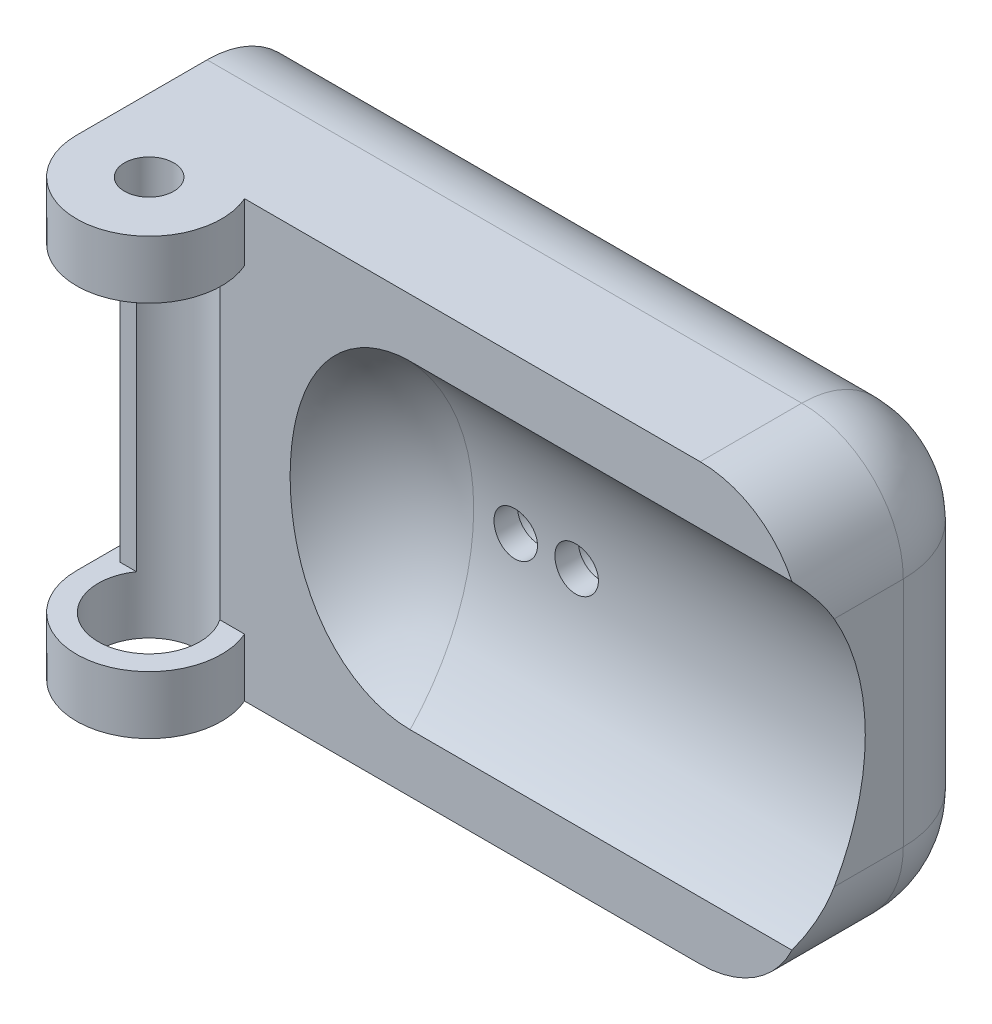
from build123d import *

# Parameters (mm, degrees)
CROQUIS1_W                  = 48
CROQUIS1_H                  = 30
SALIENTE_EXTRUIR1_DEPTH     = 14
CORTAR_EXTRUIR1_DEPTH       = 37
REDONDEO2_R                 = 7
CROQUIS3_W                  = 20
CROQUIS3_H                  = 16
CORTAR_EXTRUIR2_DEPTH       = 3
CROQUIS5_R                  = 1.5
CORTAR_EXTRUIR3_DEPTH       = 12
CROQUIS10_R                 = 6.927737764
CORTAR_EXTRUIR9_DEPTH       = 3
CORTAR_EXTRUIR10_REACH      = 54.494
CORTAR_EXTRUIR10_END_RADIUS = 6.927737764
CROQUIS11_R                 = 3
SALIENTE_EXTRUIR5_DEPTH     = 4
CORTAR_EXTRUIR14_REACH      = 59.227
CROQUIS12_R                 = 3.5
CORTAR_EXTRUIR16_DEPTH      = 22
CROQUIS16_R                 = 2
CORTAR_EXTRUIR17_DEPTH      = 2
CROQUIS17_W                 = 3
CROQUIS17_H                 = 5
CORTAR_EXTRUIR18_DEPTH      = 3
CROQUIS18_R                 = 1.7
CORTAR_EXTRUIR19_DEPTH      = 4
REDONDEO3_R                 = 10


with BuildPart() as part:
    # Croquis1 → Saliente-Extruir1 (new body)
    with BuildSketch(Plane.XY):
        with Locations((-19.976765257, 0.987352556)):
            Rectangle(CROQUIS1_W, CROQUIS1_H)
    extrude(amount=SALIENTE_EXTRUIR1_DEPTH)

    # Croquis2 → Cortar-Extruir1 (cut)
    with BuildSketch(Plane(origin=(4.023234743, 0, 0), x_dir=(0, 0, -1), z_dir=(1, 0, 0))):
        with BuildLine():
            ThreePointArc((-14, -10.012647444), (-9.618950039, 0.987352556), (-14, 11.987352556))
            Line((-14, 11.987352556), (-14, -10.012647444))
        make_face()
    extrude(amount=-CORTAR_EXTRUIR1_DEPTH, mode=Mode.SUBTRACT)

    # Redondeo2
    # the kernel refuses this fillet: 7 mm, written as the material it takes off along each edge
    with BuildSketch(Plane(origin=(-2.976765257, -7.012647444, 7), x_dir=(0, 0, -1), z_dir=(1, 0, 0))) as redondeo2_piece_1_section:
        Polygon((0, 0), (REDONDEO2_R, 0), (REDONDEO2_R, -REDONDEO2_R), (0, -REDONDEO2_R), align=None)
    redondeo2_piece_1 = extrude(amount=REDONDEO2_R, mode=Mode.PRIVATE)
    redondeo2_piece_1 = redondeo2_piece_1 - Plane(origin=(-2.976765257, -7.012647444, 7), x_dir=(0, 0.7071067811865475, 0.7071067811865475), z_dir=(1, 0, 0)) * Sphere(REDONDEO2_R, mode=Mode.PRIVATE)
    add(redondeo2_piece_1, mode=Mode.SUBTRACT)
    with BuildSketch(Plane(origin=(-2.976765257, 8.987352556, 7), x_dir=(1, 0, 0), z_dir=(0, 1, 0))) as redondeo2_piece_2_section:
        Polygon((0, 0), (REDONDEO2_R, 0), (REDONDEO2_R, REDONDEO2_R), (0, REDONDEO2_R), align=None)
    redondeo2_piece_2 = extrude(amount=REDONDEO2_R, mode=Mode.PRIVATE)
    redondeo2_piece_2 = redondeo2_piece_2 - Plane(origin=(-2.976765257, 8.987352556, 7), x_dir=(-0.7071067811865475, 0, 0.7071067811865475), z_dir=(0, 1, 0)) * Sphere(REDONDEO2_R, mode=Mode.PRIVATE)
    add(redondeo2_piece_2, mode=Mode.SUBTRACT)
    with BuildSketch(Plane(origin=(-2.976765257, -14.012647444, 0), x_dir=(0, 1, 0), z_dir=(-1, 0, 0))) as redondeo2_piece_3:
        with BuildLine():
            CenterArc((REDONDEO2_R, -REDONDEO2_R), REDONDEO2_R, 90, 90)
            Line((0, -REDONDEO2_R), (0, 0))
            Line((0, 0), (REDONDEO2_R, 0))
        make_face()
    extrude(amount=58.5, mode=Mode.SUBTRACT)
    with BuildSketch(Plane(origin=(4.023234743, 8.987352556, 0), x_dir=(0, 0, 1), z_dir=(0, -1, 0))) as redondeo2_piece_4:
        with BuildLine():
            CenterArc((REDONDEO2_R, REDONDEO2_R), REDONDEO2_R, 180, 90)
            Line((0, REDONDEO2_R), (0, 0))
            Line((0, 0), (REDONDEO2_R, 0))
        make_face()
    extrude(amount=16, mode=Mode.SUBTRACT)
    with BuildSketch(Plane(origin=(-61.476765257, 15.987352556, 0), x_dir=(0, 0, 1), z_dir=(1, 0, 0))) as redondeo2_piece_5:
        with BuildLine():
            CenterArc((REDONDEO2_R, REDONDEO2_R), REDONDEO2_R, 180, 90)
            Line((0, REDONDEO2_R), (0, 0))
            Line((0, 0), (REDONDEO2_R, 0))
        make_face()
    extrude(amount=58.5, mode=Mode.SUBTRACT)
    with BuildSketch(Plane(origin=(4.023234743, 15.987352556, 7), x_dir=(-1, 0, 0), z_dir=(0, 0, 1)), Plane(origin=(4.023234743, -14.012647444, 7), x_dir=(0, 1, 0), z_dir=(0, 0, 1))) as redondeo2_piece_6:
        with BuildLine():
            CenterArc((REDONDEO2_R, REDONDEO2_R), REDONDEO2_R, 180, 90)
            Line((0, REDONDEO2_R), (0, 0))
            Line((0, 0), (REDONDEO2_R, 0))
        make_face()
    extrude(amount=24.5, mode=Mode.SUBTRACT)

    # Croquis3 → Cortar-Extruir2 (cut)
    with BuildSketch(Plane(origin=(0, 0, 0), x_dir=(-1, 0, 0), z_dir=(0, 0, -1))):
        with Locations((18.976765257, 0.987352556)):
            Rectangle(CROQUIS3_W, CROQUIS3_H)
    extrude(amount=-CORTAR_EXTRUIR2_DEPTH, mode=Mode.SUBTRACT)

    # Croquis5 → Cortar-Extruir3 (cut)
    with BuildSketch(Plane(origin=(0, 0, 0), x_dir=(-1, 0, 0), z_dir=(0, 0, -1))):
        with Locations((20.076765257, 0.987352556)):
            Circle(CROQUIS5_R)
        with Locations((15.876765257, 0.987352556)):
            Circle(CROQUIS5_R)
    extrude(amount=-CORTAR_EXTRUIR3_DEPTH, mode=Mode.SUBTRACT)

    # Croquis10 → Cortar-Extruir9 (cut)
    with BuildSketch(Plane(origin=(0, 0, 3), x_dir=(-1, 0, 0), z_dir=(0, 0, -1))):
        with Locations((17.983902927, 0.987352556)):
            Circle(CROQUIS10_R)
    extrude(amount=-CORTAR_EXTRUIR9_DEPTH, mode=Mode.SUBTRACT)

    # Cortar-Extruir10: up to this cylinder (the profile starts outside it)
    cortar_extruir10_end = Plane(origin=(-17.983902927, 0.987352556, 4.236484), z_dir=(0, 0, -1)) * Cylinder(CORTAR_EXTRUIR10_END_RADIUS, 123.843475528, mode=Mode.PRIVATE)
    # Croquis11 → Cortar-Extruir10 (cut, up to the surface)
    with BuildSketch(Plane.ZY.offset(43.976765257), mode=Mode.PRIVATE) as cortar_extruir10_sk1:
        with Locations(Location((4.236484056, 0.987352556, 0), (0, 0, 270))):
            Circle(CROQUIS11_R)
    cortar_extruir10_tool1 = extrude(cortar_extruir10_sk1.sketch, amount=-CORTAR_EXTRUIR10_REACH, mode=Mode.PRIVATE) - cortar_extruir10_end
    add(cortar_extruir10_tool1.solids().sort_by_distance((-43.976765, 0.987353, 4.236484))[0], mode=Mode.SUBTRACT)

    # Croquis14 → Saliente-Extruir5 (add)
    with BuildSketch(Plane.XZ.offset(14.012647444)):
        with BuildLine():
            ThreePointArc((-33.976765257, 16), (-38.976765257, 21), (-43.976765257, 16))
            ThreePointArc((-43.976765257, 16), (-43.871296822, 14.978451782), (-43.559340952, 14))
            Line((-43.559340952, 14), (-34.394189562, 14))
            ThreePointArc((-34.394189562, 14), (-34.082233692, 14.978451782), (-33.976765257, 16))
        make_face()
        with BuildLine():
            Line((-34.394189562, 14), (-43.559340952, 14))
            ThreePointArc((-43.559340952, 14), (-38.976765257, 11), (-34.394189562, 14))
        make_face()
        with BuildLine():
            ThreePointArc((-43.559340952, 14), (-43.871296822, 14.978451782), (-43.976765257, 16))
            Line((-43.976765257, 16), (-43.976765257, 14))
            Line((-43.976765257, 14), (-43.559340952, 14))
        make_face()
    saliente_extruir5 = extrude(amount=-SALIENTE_EXTRUIR5_DEPTH)

    # Simetría1: Saliente-Extruir5 across plane
    add(saliente_extruir5.mirror(Plane.ZX.offset(0.987352556)))

    # Cortar-Extruir14: up to this face of the body (flat: up to its plane)
    cortar_extruir14_end = Plane(part.part.faces().sort_by_distance((-38.999365489, 11.987352556, 17.080483699))[0])
    # Croquis12 → Cortar-Extruir14 (cut, up to the picked face)
    with BuildSketch(Plane.XZ.offset(14.012647444), mode=Mode.PRIVATE) as cortar_extruir14_sk1:
        with Locations(Location((-38.976765257, 16, 0), (0, 0, 270))):
            Circle(CROQUIS12_R)
    cortar_extruir14_tool1 = split(extrude(cortar_extruir14_sk1.sketch, amount=-CORTAR_EXTRUIR14_REACH, mode=Mode.PRIVATE), bisect_by=cortar_extruir14_end, keep=Keep.BOTH, mode=Mode.PRIVATE)
    add(cortar_extruir14_tool1.solids().sort_by(Axis((-38.976765, -14.012647, 16), (0, 1, 0)))[0], mode=Mode.SUBTRACT)

    # Croquis15 → Cortar-Extruir16 (cut)
    with BuildSketch(Plane.XZ.offset(10.012647444)):
        Polygon((-43.976765257, 16), (-43.976765257, 12), (-41.976765257, 16), align=None)
    extrude(amount=-CORTAR_EXTRUIR16_DEPTH, mode=Mode.SUBTRACT)

    # Croquis16 → Cortar-Extruir17 (cut)
    with BuildSketch(Plane(origin=(0, 0, 6), x_dir=(-1, 0, 0), z_dir=(0, 0, -1))):
        with Locations((15.876765257, 0.987352556)):
            Circle(CROQUIS16_R)
        with Locations((20.076765257, 0.987352556)):
            Circle(CROQUIS16_R)
    extrude(amount=-CORTAR_EXTRUIR17_DEPTH, mode=Mode.SUBTRACT)

    # Croquis17 → Cortar-Extruir18 (cut)
    with BuildSketch(Plane(origin=(0, 0, 0), x_dir=(-1, 0, 0), z_dir=(0, 0, -1))):
        with Locations((30.476765257, 0.987352556)):
            Rectangle(CROQUIS17_W, CROQUIS17_H)
    extrude(amount=-CORTAR_EXTRUIR18_DEPTH, mode=Mode.SUBTRACT)

    # Croquis18 → Cortar-Extruir19 (cut)
    with BuildSketch(Plane(origin=(0, 15.987352556, 0), x_dir=(1, 0, 0), z_dir=(0, 1, 0))):
        with Locations(Location((-38.976765257, -16, 0), (0, 0, 270))):
            Circle(CROQUIS18_R)
    extrude(amount=-CORTAR_EXTRUIR19_DEPTH, mode=Mode.SUBTRACT)

    # Redondeo3
    # the kernel refuses this fillet: 10 mm, written as the material it adds along each edge
    with BuildSketch(Plane(origin=(-32.976765257, 0.987352556, 25.618950039), x_dir=(0, -0.7314644805706508, 0.6818795448343558), z_dir=(0, 0.6818795448343558, 0.7314644805706508))) as redondeo3_piece_1_section:
        with BuildLine():
            CenterArc((16 - REDONDEO3_R, REDONDEO3_R), REDONDEO3_R, 270, 90)
            Line((16 - REDONDEO3_R, 0), (16, 0))
            Line((16, 0), (16, REDONDEO3_R))
        make_face()
    redondeo3_piece_1 = revolve(axis=Axis((-32.976765257, 0.987352556, 25.618950039), (1, 0, 0)), revolution_arc=265.981384943, mode=Mode.PRIVATE)
    redondeo3_piece_1 = split(redondeo3_piece_1, bisect_by=Plane(origin=(-29.991953526, 0.987352592, 14), z_dir=(0, 0, -1)), keep=Keep.TOP, mode=Mode.PRIVATE)
    add(redondeo3_piece_1)


solid = part.part
